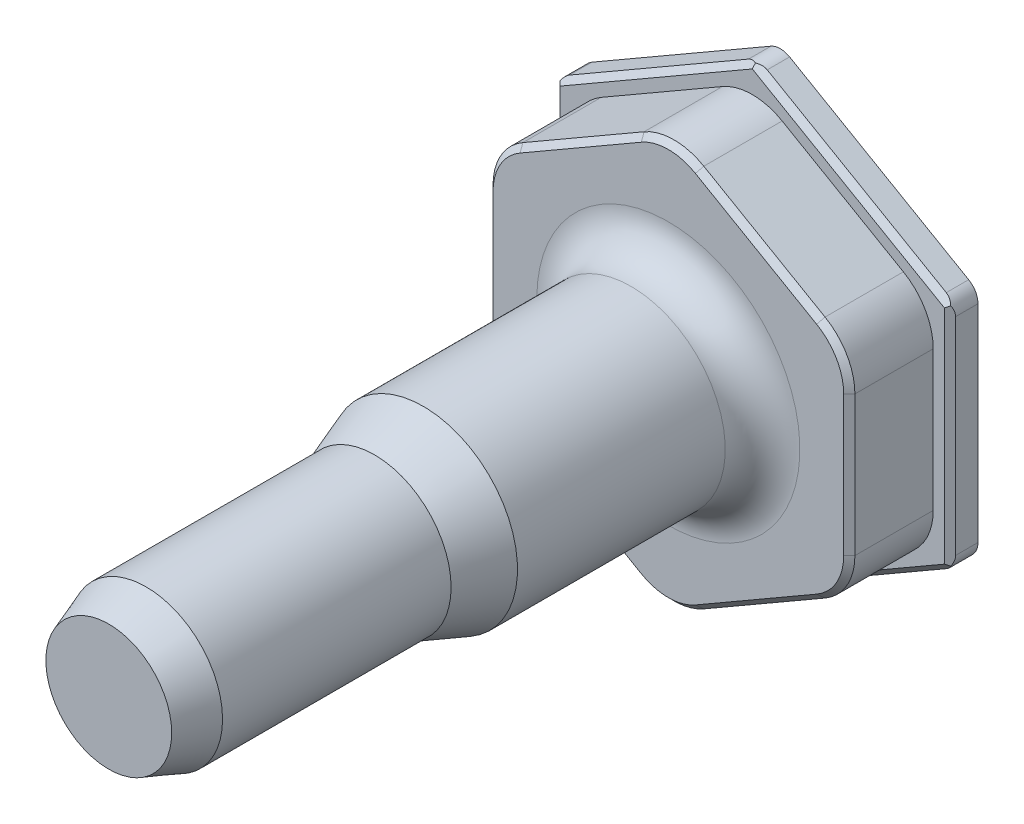
from build123d import *

# Parameters (mm, degrees)
BOSS_EXTRUDE1_DEPTH  = 1.5
SKETCH1_8_R          = 4.1
BOSS_EXTRUDE3_DEPTH  = 36
SKETCH1_9_R          = 5.05
BOSS_EXTRUDE4_DEPTH  = 19
SHELL1_START         = 2
SHELL1_OUTLINE_R     = 2.1
SHELL1_DEPTH         = 32
SHELL1_2_OUTLINE_R   = 3.05
SHELL1_2_OUTLINE_R_2 = 2.1
SHELL1_2_DEPTH       = 15
SKETCH1_10_R         = 3.25
CUT_EXTRUDE1_DEPTH   = 17
SKETCH1_3_R          = 3.25
BOSS_EXTRUDE2_DEPTH  = 6
CHAMFER1_SIZE        = 2
CHAMFER1_SIZE2       = 0.727940469
CHAMFER2_SIZE        = 2.747477419
CHAMFER2_SIZE_2      = 1
CHAMFER3_SIZE        = 1.212435565
CHAMFER3_SIZE_2      = 0.7
CHAMFER6_SIZE        = 0.3
FILLET1_R            = 3.2
CHAMFER5_SIZE        = 0.3
FILLET2_R            = 1
FILLET3_R            = 2


# Read off the part's stored shape, not the designer's step: Shell1
with BuildPart() as part:
    # Sketch1 → Boss-Extrude1 (new body)
    with BuildSketch(Plane.XY):
        Polygon((-10.6, 6.119912853), (0, 12.239825707), (10.6, 6.119912853), (10.6, -6.119912853), (0, -12.239825707), (-10.6, -6.119912853), align=None)
    extrude(amount=BOSS_EXTRUDE1_DEPTH)

    # Sketch1<8> → Boss-Extrude3 (add)
    with BuildSketch(Plane.XY):
        with Locations(Location((0, 0, 0), (0, 0, 180))):
            Circle(SKETCH1_8_R)
    extrude(amount=BOSS_EXTRUDE3_DEPTH)

    # Sketch1<9> → Boss-Extrude4 (add)
    with BuildSketch(Plane.XY):
        with Locations(Location((0, 0, 0), (0, 0, 180))):
            Circle(SKETCH1_9_R)
    extrude(amount=BOSS_EXTRUDE4_DEPTH)

    # Shell1 outline → Shell1 (cut)
    with BuildSketch(Plane.XY.offset(SHELL1_START)):
        Circle(SHELL1_OUTLINE_R)
    extrude(amount=SHELL1_DEPTH, mode=Mode.SUBTRACT)

    # Shell1 2 outline → Shell1 2 (cut)
    with BuildSketch(Plane.XY.offset(SHELL1_START)):
        Circle(SHELL1_2_OUTLINE_R)
        Circle(SHELL1_2_OUTLINE_R_2, mode=Mode.SUBTRACT)
    extrude(amount=SHELL1_2_DEPTH, mode=Mode.SUBTRACT)

    # Sketch1<10> → Cut-Extrude1 (cut)
    with BuildSketch(Plane.XY):
        Circle(SKETCH1_10_R)
    extrude(amount=CUT_EXTRUDE1_DEPTH, mode=Mode.SUBTRACT)

    # Sketch1<3> → Boss-Extrude2 (add)
    with BuildSketch(Plane.XY):
        Polygon((0, 11.200595222), (9.7, 5.600297611), (9.7, -5.600297611), (0, -11.200595222), (-9.7, -5.600297611), (-9.7, 5.600297611), align=None)
        Circle(SKETCH1_3_R, mode=Mode.SUBTRACT)
    extrude(amount=BOSS_EXTRUDE2_DEPTH)

    # Chamfer1
    chamfer1_edges = [part.edges().sort_by_distance(p)[0] for p in [
        (4.1, 0, 36),
    ]]
    chamfer1_side = [part.faces().sort_by_distance(p)[0] for p in [
        (4.1, 0, 27.5),
    ]]
    chamfer(chamfer1_edges, length=CHAMFER1_SIZE, length2=CHAMFER1_SIZE2, reference=chamfer1_side[0])

    # Chamfer2
    # the kernel refuses this chamfer: 2.747477419, 1 mm, written as the material it adds along each edge
    with BuildSketch(Plane(origin=(0, 0, 19), x_dir=(-1, 0, 0), z_dir=(0, -1, 0))) as chamfer2_piece_1_section:
        Polygon((4.1, -CHAMFER2_SIZE), (4.1 + CHAMFER2_SIZE_2, 0), (4.1, 0), align=None)
    chamfer2_piece_1 = revolve(axis=Axis((0, 0, 19), (0, 0, -1)), mode=Mode.PRIVATE)
    chamfer2_piece_1 = chamfer2_piece_1 & Plane(origin=(0, 0, 20.481947897), x_dir=(-1, 0, 0), z_dir=(0, 0, -1)) * Cylinder(5.05, 21, mode=Mode.PRIVATE)
    add(chamfer2_piece_1)

    # Chamfer3
    # the kernel refuses this chamfer: 1.212435565, 0.7 mm, written as the material it takes off along each edge
    with BuildSketch(Plane(origin=(0, 0, 17), x_dir=(1, 0, 0), z_dir=(0, -1, 0))) as chamfer3_piece_1_section:
        Polygon((2.1 + CHAMFER3_SIZE, 0), (2.1, CHAMFER3_SIZE_2), (2.1, 0), align=None)
    chamfer3_piece_1 = revolve(axis=Axis((0, 0, 17), (0, 0, 1)), mode=Mode.PRIVATE)
    chamfer3_piece_1 = chamfer3_piece_1 & Plane(origin=(0, 0, 17.363214185), x_dir=(1, 0, 0), z_dir=(0, 0, -1)) * Cylinder(3.25, 14, mode=Mode.PRIVATE)
    add(chamfer3_piece_1, mode=Mode.SUBTRACT)

    # Chamfer6
    chamfer6_edges = [part.edges().sort_by_distance(p)[0] for p in [
        (-3.25, 0, 0),
    ]]
    chamfer(chamfer6_edges, length=CHAMFER6_SIZE)

    # Fillet1
    fillet1_edges = [part.edges().sort_by_distance(p)[0] for p in [
        (-9.7, -5.600297611, 3.75),
        (0, -11.200595222, 3.75),
        (9.7, -5.600297611, 3.75),
        (9.7, 5.600297611, 3.75),
        (0, 11.200595222, 3.75),
        (-9.7, 5.600297611, 3.75),
    ]]
    fillet(fillet1_edges, radius=FILLET1_R)

    # Chamfer5
    chamfer5_edges = [part.edges().sort_by_distance(p)[0] for p in [
        (-4.85, -8.400446417, 6),
        (4.85, 8.400446417, 6),
        (-4.85, 8.400446417, 6),
        (-9.7, 0, 6),
        (9.271281292, 5.35277675, 6),
        (0, 10.705553499, 6),
        (-9.271281292, 5.35277675, 6),
        (-9.271281292, -5.35277675, 6),
        (0, -10.705553499, 6),
        (9.271281292, -5.35277675, 6),
        (5.3, 9.17986928, 1.5),
        (10.6, 0, 1.5),
        (5.3, -9.17986928, 1.5),
        (-5.3, -9.17986928, 1.5),
        (-10.6, 0, 1.5),
        (-5.3, 9.17986928, 1.5),
        (9.7, 0, 6),
        (4.85, -8.400446417, 6),
    ]]
    chamfer(chamfer5_edges, length=CHAMFER5_SIZE)

    # Fillet2
    fillet2_edges = [part.edges().sort_by_distance(p)[0] for p in [
        (10.6, 6.119912853, 0.6),
        (10.6, -6.119912853, 0.6),
        (0, -12.239825707, 0.6),
        (-10.6, -6.119912853, 0.6),
        (-10.6, 6.119912853, 0.6),
        (0, 12.239825707, 0.6),
    ]]
    fillet(fillet2_edges, radius=FILLET2_R)

    # Fillet3
    fillet3_edges = [part.edges().sort_by_distance(p)[0] for p in [
        (5.05, 0, 6),
    ]]
    fillet(fillet3_edges, radius=FILLET3_R)


solid = part.part
